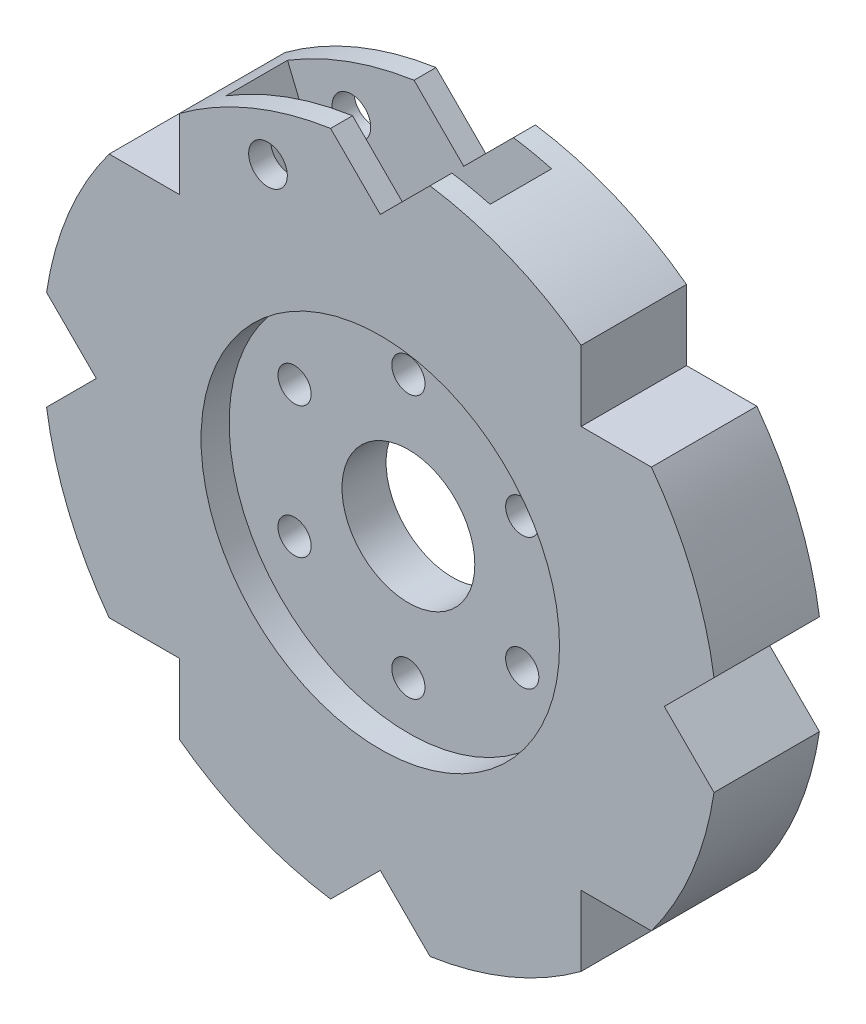
from build123d import *

# Parameters (mm, degrees)
BOSS_EXTRUDE1_DEPTH   = 19.05
SKETCH2_R             = 12
CUT_EXTRUDE1_DEPTH    = 88.371938859
SKETCH3_R             = 32.385
CUT_EXTRUDE2_DEPTH    = 5.08
SKETCH4_R             = 28.4
CUT_EXTRUDE3_DEPTH    = 6
F_6_0MM_DOWEL_HOLE1_D = 6
SKETCH9_R             = 3.4925
CUT_EXTRUDE4_DEPTH    = 5.55625
SKETCH10_R            = 3.4925
CUT_EXTRUDE5_DEPTH    = 88.371938859
CUT_EXTRUDE6_DEPTH    = 5.55625


with BuildPart() as part:
    # Sketch1 → Boss-Extrude1 (new body)
    with BuildSketch(Plane.XY):
        with BuildLine():
            Line((-8.980256121, 60.29491355), (0, 51.314657429))
            Line((0, 51.314657429), (8.980256121, 60.29491355))
            ThreePointArc((8.980256121, 60.29491355), (23.328382037, 56.319696302), (36.284942242, 48.984942242))
            Line((36.284942242, 48.984942242), (36.284942242, 36.284942242))
            Line((36.284942242, 36.284942242), (48.984942242, 36.284942242))
            ThreePointArc((48.984942242, 36.284942242), (56.319696302, 23.328382037), (60.29491355, 8.980256121))
            Line((60.29491355, 8.980256121), (51.314657429, 0))
            Line((51.314657429, 0), (60.29491355, -8.980256121))
            ThreePointArc((60.29491355, -8.980256121), (56.319696302, -23.328382037), (48.984942242, -36.284942242))
            Line((48.984942242, -36.284942242), (36.284942242, -36.284942242))
            Line((36.284942242, -36.284942242), (36.284942242, -48.984942242))
            ThreePointArc((36.284942242, -48.984942242), (23.328382037, -56.319696302), (8.980256121, -60.29491355))
            Line((8.980256121, -60.29491355), (0, -51.314657429))
            Line((0, -51.314657429), (-8.980256121, -60.29491355))
            ThreePointArc((-8.980256121, -60.29491355), (-23.328382037, -56.319696302), (-36.284942242, -48.984942242))
            Line((-36.284942242, -48.984942242), (-36.284942242, -36.284942242))
            Line((-36.284942242, -36.284942242), (-48.984942242, -36.284942242))
            ThreePointArc((-48.984942242, -36.284942242), (-56.319696302, -23.328382037), (-60.29491355, -8.980256121))
            Line((-60.29491355, -8.980256121), (-51.314657429, 0))
            Line((-51.314657429, 0), (-60.29491355, 8.980256121))
            ThreePointArc((-60.29491355, 8.980256121), (-56.319696302, 23.328382037), (-48.984942242, 36.284942242))
            Line((-48.984942242, 36.284942242), (-36.284942242, 36.284942242))
            Line((-36.284942242, 36.284942242), (-36.284942242, 48.984942242))
            ThreePointArc((-36.284942242, 48.984942242), (-23.328382037, 56.319696302), (-8.980256121, 60.29491355))
        make_face()
    extrude(amount=BOSS_EXTRUDE1_DEPTH)

    # Sketch2 → Cut-Extrude1 (cut, through all)
    with BuildSketch(Plane.XY.offset(19.05)):
        Circle(SKETCH2_R)
    extrude(amount=-CUT_EXTRUDE1_DEPTH, mode=Mode.SUBTRACT)

    # Sketch3 → Cut-Extrude2 (cut)
    with BuildSketch(Plane.XY.offset(19.05)):
        Circle(SKETCH3_R)
    extrude(amount=-CUT_EXTRUDE2_DEPTH, mode=Mode.SUBTRACT)

    # Sketch4 → Cut-Extrude3 (cut)
    with BuildSketch(Plane(origin=(0, 0, 0), x_dir=(-1, 0, 0), z_dir=(0, 0, -1))):
        Circle(SKETCH4_R)
    extrude(amount=-CUT_EXTRUDE3_DEPTH, mode=Mode.SUBTRACT)

    # Ø6.0mm Dowel Hole1 (through all)
    with Locations(Plane(origin=(0, 0, 6), x_dir=(-1, 0, 0), z_dir=(0, 0, -1))):
        with Locations((0, 23.75), (20.56810334, 11.875), (20.56810334, -11.875), (0, -23.75), (-20.56810334, 11.875), (-20.56810334, -11.875)):
            Hole(F_6_0MM_DOWEL_HOLE1_D / 2)

    # Sketch9 → Cut-Extrude4 (cut, symmetric)
    with BuildSketch(Plane(origin=(0, 0, 9.525), x_dir=(-1, 0, 0), z_dir=(0, 0, -1))):
        Polygon((17.253282548, 41.653108723), (8.453330001, 45.298168417), (14.52842949, 59.964755995), (32.128334584, 52.674636609), (26.053235095, 38.00804903), align=None)
        with Locations((20.290832293, 48.986402513)):
            Circle(SKETCH9_R, mode=Mode.SUBTRACT)
    extrude(amount=CUT_EXTRUDE4_DEPTH, both=True, mode=Mode.SUBTRACT)

    # Sketch10 → Cut-Extrude5 (cut, through all)
    with BuildSketch(Plane(origin=(0, 0, 0), x_dir=(-1, 0, 0), z_dir=(0, 0, -1))):
        with Locations((20.290832293, 48.986402513)):
            Circle(SKETCH10_R)
    extrude(amount=-CUT_EXTRUDE5_DEPTH, mode=Mode.SUBTRACT)

    # Sketch11 → Cut-Extrude6 (cut, symmetric)
    with BuildSketch(Plane(origin=(0, 0, 9.525), x_dir=(-1, 0, 0), z_dir=(0, 0, -1))):
        Polygon((0, 38.1), (-15.875, 38.1), (-15.875, 63.5), (15.875, 63.5), (15.875, 38.1), align=None)
    extrude(amount=CUT_EXTRUDE6_DEPTH, both=True, mode=Mode.SUBTRACT)


solid = part.part
